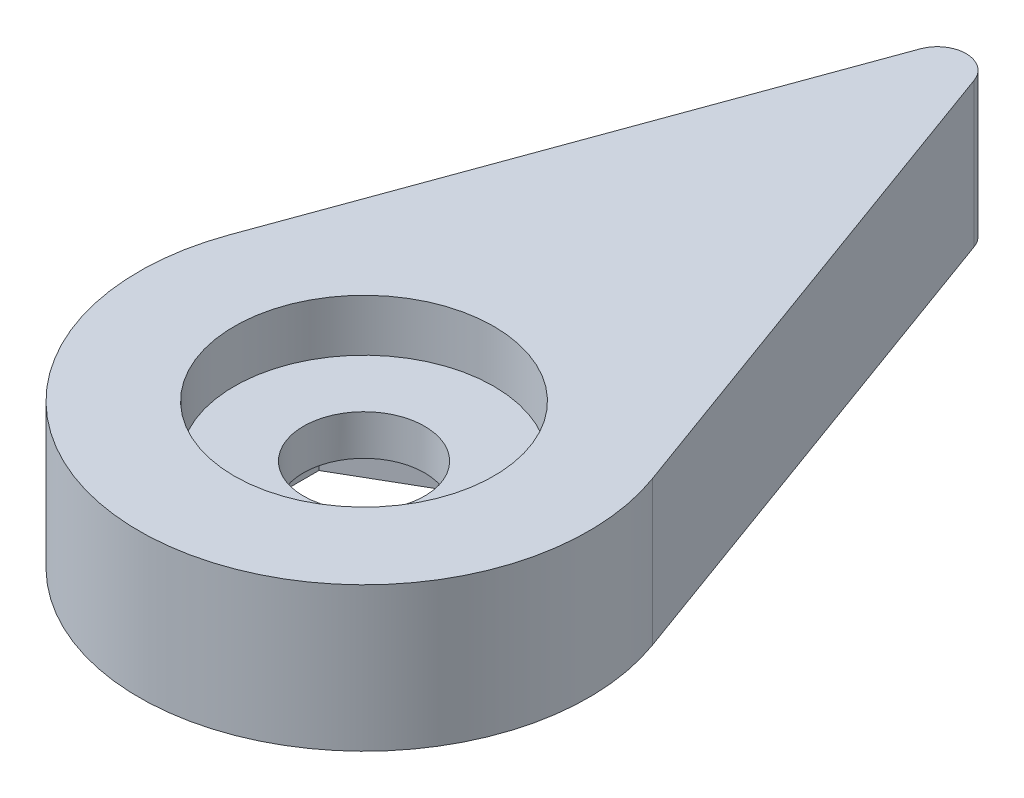
from build123d import *

# Parameters (mm, degrees)
BOSS_EXTRUDE2_DEPTH = 5
CUT_EXTRUDE1_REACH  = 24.845
SKETCH3_R           = 2.1
SKETCH4_R           = 4.5
CUT_EXTRUDE2_DEPTH  = 1.8
CUT_EXTRUDE3_DEPTH  = 1.8


with BuildPart() as part:
    # Sketch1 → Boss-Extrude2 (new body)
    with BuildSketch(Plane(origin=(0, 0, 0), x_dir=(1, 0, 0), z_dir=(0, 1, 0))):
        with BuildLine():
            Line((-0.939692556, 20.223890242), (-7.329602442, 2.667757118))
            ThreePointArc((-7.329602442, 2.667757118), (0, -7.8), (7.329602442, 2.667757118))
            Line((7.329602442, 2.667757118), (0.939692556, 20.223890242))
            ThreePointArc((0.939692556, 20.223890242), (0, 20.881870053), (-0.939692556, 20.223890242))
        make_face()
    extrude(amount=BOSS_EXTRUDE2_DEPTH)

    # Sketch3 → Cut-Extrude1 (cut, up to next)
    with BuildSketch(Plane(origin=(0, 5, 0), x_dir=(1, 0, 0), z_dir=(0, 1, 0)), mode=Mode.PRIVATE) as cut_extrude1_sk1:
        Circle(SKETCH3_R)
    cut_extrude1_tool1 = extrude(cut_extrude1_sk1.sketch, amount=-CUT_EXTRUDE1_REACH, mode=Mode.PRIVATE) & part.part
    add(cut_extrude1_tool1.solids().sort_by_distance((0, 5, 0))[0], mode=Mode.SUBTRACT)

    # Sketch4 → Cut-Extrude2 (cut)
    with BuildSketch(Plane(origin=(0, 5, 0), x_dir=(1, 0, 0), z_dir=(0, 1, 0))):
        Circle(SKETCH4_R)
    extrude(amount=-CUT_EXTRUDE2_DEPTH, mode=Mode.SUBTRACT)

    # Sketch5 → Cut-Extrude3 (cut)
    with BuildSketch(Plane.XZ):
        Polygon((0, 4.272391992), (-3.7, 2.136195996), (-3.7, -2.136195996), (0, -4.272391992), (3.7, -2.136195996), (3.7, 2.136195996), align=None)
    extrude(amount=-CUT_EXTRUDE3_DEPTH, mode=Mode.SUBTRACT)


solid = part.part
